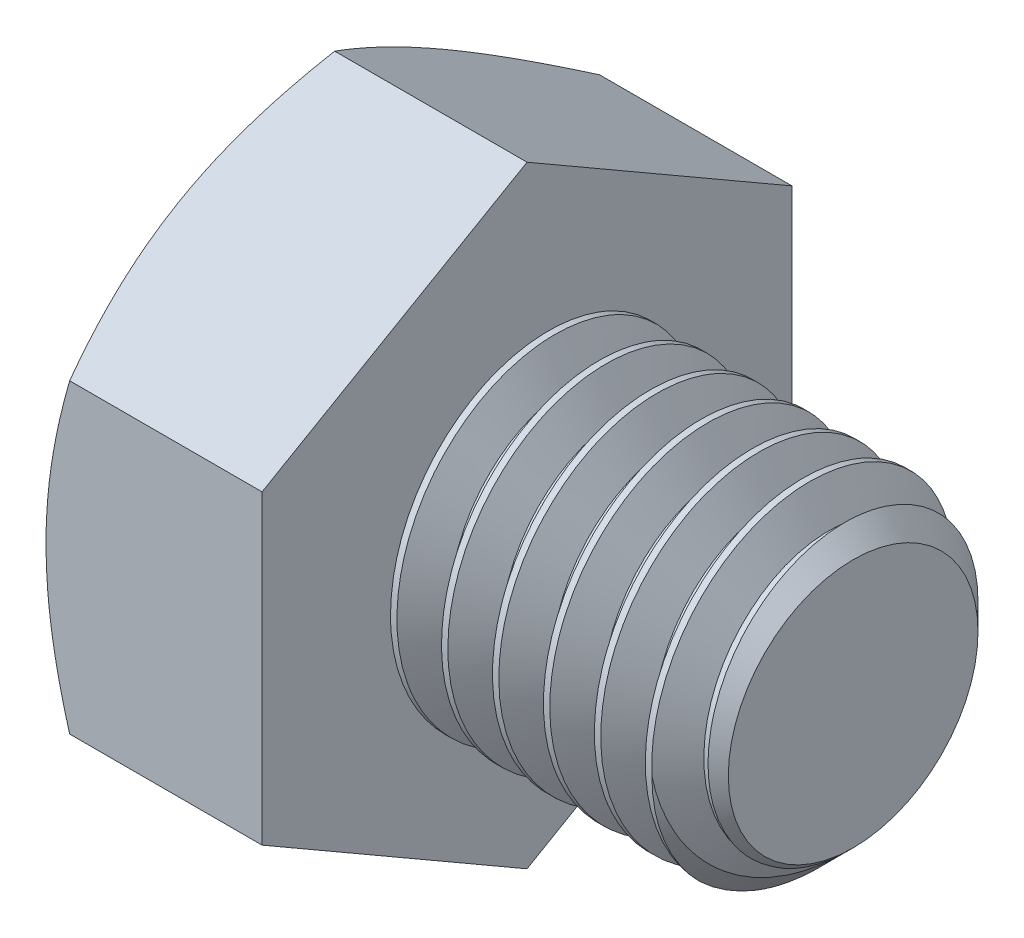
from build123d import *

# Parameters (mm, degrees)
SKETCH2_R           = 4
BOSS_EXTRUDE1_DEPTH = 8
CHAMFER1_SIZE       = 0.9375
CUT_SWEEP1_PITCH    = 1.25
BOSS_EXTRUDE2_DEPTH = 5.3
SKETCH6_OUTSIDE_W   = 80.74
SKETCH6_OUTSIDE_H   = 82.752
SKETCH6_OUTSIDE_R   = 6.5
CUT_EXTRUDE1_DEPTH  = 17.597389517
CUT_EXTRUDE1_DRAFT  = -60
SKETCH7_W           = 0.197562976
SKETCH7_H           = 0.197562976
CUT_EXTRUDE2_DEPTH  = 0.25


with BuildPart() as part:
    # Sketch2 → Boss-Extrude1 (new body)
    with BuildSketch(Plane(origin=(6.65, 0, 0), x_dir=(0, 0, -1), z_dir=(1, 0, 0))):
        Circle(SKETCH2_R)
    extrude(amount=-BOSS_EXTRUDE1_DEPTH)

    # Chamfer1
    chamfer1_edges = [part.edges().sort_by_distance(p)[0] for p in [
        (6.65, 0, 4),
    ]]
    chamfer(chamfer1_edges, length=CHAMFER1_SIZE)

    # Cut-Sweep1: the profile of Sketch5 profile screwed along a right-hand helix of 7.4 turns, 8 arcs to a turn; built about Z, then put on its axis
    cut_sweep1_z = Axis((0, 0, 0), (0, 0, 1))
    cut_sweep1_corners = [(4.0003, 0, 0.000173205), (3.188101184, 0, -0.46875), (3.188101184, 0, -0.625), (4.0003, 0, -1.093923205)]
    with BuildLine(mode=Mode.PRIVATE) as cut_sweep1_profile:
        Line(cut_sweep1_corners[0], cut_sweep1_corners[1])
        Line(cut_sweep1_corners[1], cut_sweep1_corners[2])
        Line(cut_sweep1_corners[2], cut_sweep1_corners[3])
        Line(cut_sweep1_corners[3], cut_sweep1_corners[0])
    cut_sweep1_cap = Face(cut_sweep1_profile.wire())
    cut_sweep1_turn_angles = [0, 22.5, 45, 67.5, 90, 112.5, 135, 157.5, 180, 202.5, 225, 247.5, 270, 292.5, 315, 337.5, 360]
    cut_sweep1_turn_weights = [1, 0.9238795325112867, 1, 0.9238795325112867, 1, 0.9238795325112867, 1, 0.9238795325112867, 1, 0.9238795325112867, 1, 0.9238795325112867, 1, 0.9238795325112867, 1, 0.9238795325112867, 1]
    cut_sweep1_turn_rails = [Edge.make_bspline([Vector(p[0], p[1], 0).rotate(cut_sweep1_z, cut_sweep1_turn_angles[k]) / cut_sweep1_turn_weights[k] + Vector(0, 0, p[2] + CUT_SWEEP1_PITCH * cut_sweep1_turn_angles[k] / 360) for k in range(17)], [0, 0, 0, 1, 1, 2, 2, 3, 3, 4, 4, 5, 5, 6, 6, 7, 7, 8, 8, 8], 2, cut_sweep1_turn_weights) for p in cut_sweep1_corners]
    cut_sweep1_turn_sides = [Face.make_surface_from_curves(cut_sweep1_turn_rails[p[0]], cut_sweep1_turn_rails[p[1]]) for p in [(0, 1), (1, 2), (2, 3), (3, 0)]]
    cut_sweep1_last_angles = [2520, 2542.5, 2565, 2587.5, 2610, 2632.5, 2655, 2659.5, 2664]
    cut_sweep1_last_weights = [1, 0.9238795325112867, 1, 0.9238795325112867, 1, 0.9238795325112867, 1, 0.9969173337331242, 1]
    cut_sweep1_last_rails = [Edge.make_bspline([Vector(p[0], p[1], 0).rotate(cut_sweep1_z, cut_sweep1_last_angles[k]) / cut_sweep1_last_weights[k] + Vector(0, 0, p[2] + CUT_SWEEP1_PITCH * cut_sweep1_last_angles[k] / 360) for k in range(9)], [0, 0, 0, 1, 1, 2, 2, 3, 3, 4, 4, 4], 2, cut_sweep1_last_weights) for p in cut_sweep1_corners]
    cut_sweep1_last_sides = [Face.make_surface_from_curves(cut_sweep1_last_rails[p[0]], cut_sweep1_last_rails[p[1]]) for p in [(0, 1), (1, 2), (2, 3), (3, 0)]]
    cut_sweep1 = Plane(origin=(6.65, 0, 0), x_dir=(0, 1, 0), z_dir=(-1, 0, 0)) * Solid(Shell([*[p.moved(Location((0, 0, CUT_SWEEP1_PITCH * i))) for i in range(7) for p in cut_sweep1_turn_sides], *cut_sweep1_last_sides, cut_sweep1_cap, cut_sweep1_cap.rotate(cut_sweep1_z, 2664).moved(Location((0, 0, CUT_SWEEP1_PITCH * 2664 / 360)))]))
    add(cut_sweep1, mode=Mode.SUBTRACT)

    # Sketch3 → Boss-Extrude2 (add)
    with BuildSketch(Plane.ZY.offset(1.35)):
        Polygon((-6.5, -3.75277675), (0, -7.505553499), (6.5, -3.75277675), (6.5, 3.75277675), (0, 7.505553499), (-6.5, 3.75277675), align=None)
    extrude(amount=BOSS_EXTRUDE2_DEPTH)


with BuildPart() as cut_extrude1_tool:
    # Sketch6 outside → Cut-Extrude1 (with draft: the straight prism first)
    with BuildSketch(Plane.ZY.offset(6.65)):
        Rectangle(SKETCH6_OUTSIDE_W, SKETCH6_OUTSIDE_H)
        Circle(SKETCH6_OUTSIDE_R, mode=Mode.SUBTRACT)
    extrude(amount=-CUT_EXTRUDE1_DEPTH)
    # Cut-Extrude1: the draft: its side faces are tilted about the plane it starts from
    cut_extrude1_sides = [cut_extrude1_tool.faces().sort_by_distance(p)[0] for p in [
        (2.148694759, -41.376, 0),
        (2.148694759, 0, 40.37),
        (2.148694759, 41.376, 0),
        (2.148694759, 0, -40.37),
        (2.148694759, 0, -6.5),
    ]]
    draft(cut_extrude1_sides, Plane.ZY.offset(6.65), CUT_EXTRUDE1_DRAFT)


with BuildPart() as part_1:
    add(part.part)

    # Cut-Extrude1: cut by cut_extrude1_tool
    add(cut_extrude1_tool.part, mode=Mode.SUBTRACT)

    # Sketch7 → Cut-Extrude2 (cut)
    # profile 1 of 3: a face of its own
    with BuildSketch(Plane.ZY.offset(6.65)):
        with BuildLine():
            add(Edge.make_bspline(
                [(-1.090300672, 4.095199106), (-1.10904591, 4.102532349), (-1.144986747, 4.116592608), (-1.19346167, 4.144731144), (-1.234487944, 4.177100824), (-1.26756182, 4.214482221), (-1.292770127, 4.256102561), (-1.310921105, 4.301431184), (-1.321552451, 4.350720623), (-1.322951659, 4.384803), (-1.323671938, 4.402347795)],
                knots=[0, 0, 0, 0, 1.16287356, 2.229614231, 3.228817875, 4.173350329, 5.100165549, 6.029633206, 6.985702163, 8, 8, 8, 8], degree=3))
            add(Edge.make_bspline(
                [(-1.323671938, 4.402347795), (-1.323332936, 4.415847741), (-1.322667465, 4.442348557), (-1.316917644, 4.481234018), (-1.307708477, 4.518496018), (-1.294638515, 4.554029389), (-1.278263995, 4.588126603), (-1.257602111, 4.620162984), (-1.233852559, 4.651043945), (-1.206031088, 4.679521184), (-1.175372308, 4.705603578), (-1.142164064, 4.728814347), (-1.106152247, 4.747795114), (-1.067937276, 4.763664634), (-1.027330198, 4.776088791), (-0.984187971, 4.784550333), (-0.938662683, 4.789932502), (-0.907467674, 4.790632812), (-0.891502928, 4.790991211)],
                knots=[0, 0, 0, 0, 0.994101948, 1.951453197, 2.889123786, 3.817215529, 4.736003873, 5.669743943, 6.620499649, 7.601567446, 8.596478358, 9.582687259, 10.579761808, 11.589151689, 12.62747492, 13.702346593, 14.8241243, 16, 16, 16, 16], degree=3))
            add(Edge.make_bspline(
                [(-0.891502928, 4.790991211), (-0.875436453, 4.790629173), (-0.844140773, 4.789923964), (-0.798373618, 4.78461411), (-0.754959136, 4.775714465), (-0.713922888, 4.763088109), (-0.675200178, 4.746944553), (-0.639045453, 4.727102003), (-0.605086523, 4.703887727), (-0.574191365, 4.677024885), (-0.546080454, 4.647860574), (-0.521725005, 4.616615726), (-0.500836111, 4.584019418), (-0.483574579, 4.54987362), (-0.470804432, 4.513789502), (-0.461070714, 4.476446906), (-0.455424706, 4.43740213), (-0.454742415, 4.410906185), (-0.454394844, 4.39740872)],
                knots=[0, 0, 0, 0, 1.171211919, 2.281388661, 3.353996503, 4.398126828, 5.406889753, 6.407389155, 7.400009931, 8.40008733, 9.387021643, 10.349004252, 11.283445052, 12.206096336, 13.131640667, 14.068727932, 15.016178647, 16, 16, 16, 16], degree=3))
            add(Edge.make_bspline(
                [(-0.454394844, 4.39740872), (-0.454959462, 4.380468619), (-0.45606657, 4.347252266), (-0.467348502, 4.299370618), (-0.484932357, 4.254670699), (-0.510346333, 4.214004413), (-0.542532189, 4.176951768), (-0.58247227, 4.144741497), (-0.629560012, 4.116646938), (-0.6645934, 4.102540833), (-0.682827035, 4.095199106)],
                knots=[0, 0, 0, 0, 0.998680737, 1.958225066, 2.887911823, 3.823713378, 4.77537694, 5.772726054, 6.840782926, 8, 8, 8, 8], degree=3))
            add(Edge.make_bspline(
                [(-0.682827035, 4.095199106), (-0.671322795, 4.091293961), (-0.648779475, 4.083641573), (-0.616909948, 4.06876297), (-0.586905745, 4.052720306), (-0.558597671, 4.035354111), (-0.533030646, 4.015372905), (-0.509351678, 3.993958093), (-0.487660326, 3.970807897), (-0.468252869, 3.945725424), (-0.450925963, 3.919237111), (-0.436092756, 3.891278379), (-0.423495199, 3.862247184), (-0.412728892, 3.832008902), (-0.404864956, 3.800350539), (-0.399362666, 3.767417581), (-0.395871617, 3.733383598), (-0.395377091, 3.71026846), (-0.395125952, 3.698529693)],
                knots=[0, 0, 0, 0, 1.104208047, 2.163768705, 3.193778962, 4.198696312, 5.179575955, 6.14024585, 7.100368562, 8.060719304, 9.021161243, 9.975749006, 10.935506756, 11.897452199, 12.89163552, 13.897859372, 14.932451246, 16, 16, 16, 16], degree=3))
            add(Edge.make_bspline(
                [(-0.395125952, 3.698529693), (-0.395518566, 3.682350494), (-0.396292046, 3.650476238), (-0.403088084, 3.603688571), (-0.413370791, 3.558742632), (-0.428364165, 3.515828291), (-0.447514428, 3.474915209), (-0.471203535, 3.436062798), (-0.499198733, 3.399311024), (-0.530674211, 3.364545652), (-0.565863777, 3.33311926), (-0.603932369, 3.305425676), (-0.645022826, 3.282228768), (-0.688636579, 3.263021811), (-0.734982466, 3.248136491), (-0.784000913, 3.237713611), (-0.835675608, 3.231507244), (-0.871009164, 3.230670526), (-0.889033391, 3.230243702)],
                knots=[0, 0, 0, 0, 1.017598406, 2.004746413, 2.969099523, 3.915171376, 4.859468899, 5.806714415, 6.772805022, 7.762836953, 8.753334612, 9.736396794, 10.719437652, 11.716790048, 12.730404696, 13.776887535, 14.865953843, 16, 16, 16, 16], degree=3))
            add(Edge.make_bspline(
                [(-0.889033391, 3.230243702), (-0.907055815, 3.230679725), (-0.942385837, 3.231534475), (-0.994107744, 3.237613962), (-1.043056058, 3.248509339), (-1.089341685, 3.26340979), (-1.133215708, 3.282096716), (-1.174030202, 3.305816309), (-1.212347458, 3.333474808), (-1.247561492, 3.365095581), (-1.279298421, 3.399857245), (-1.306924581, 3.437151785), (-1.330473058, 3.476405251), (-1.349852944, 3.517838923), (-1.364624836, 3.561453179), (-1.374991925, 3.607084275), (-1.381800265, 3.654697342), (-1.382555285, 3.687186894), (-1.38294083, 3.70377746)],
                knots=[0, 0, 0, 0, 1.127066097, 2.209429196, 3.250843736, 4.258219581, 5.246860502, 6.227045772, 7.204057202, 8.19754525, 9.181483529, 10.142920909, 11.095356922, 12.039670968, 12.998174893, 13.969127444, 14.962948905, 16, 16, 16, 16], degree=3))
            add(Edge.make_bspline(
                [(-1.38294083, 3.70377746), (-1.382672847, 3.716130371), (-1.382147017, 3.74036892), (-1.378934902, 3.775920275), (-1.372533218, 3.809804454), (-1.364287442, 3.842221135), (-1.353817885, 3.873251416), (-1.340901695, 3.902651616), (-1.325231028, 3.930350678), (-1.307428123, 3.956528839), (-1.287268328, 3.981002318), (-1.265078386, 4.003556797), (-1.240777693, 4.023935731), (-1.214912328, 4.04273433), (-1.18639811, 4.058622835), (-1.156295471, 4.073203498), (-1.124086869, 4.0856381), (-1.101675528, 4.091980186), (-1.090300672, 4.095199106)],
                knots=[0, 0, 0, 0, 1.117345089, 2.192424383, 3.22371675, 4.232639188, 5.215561493, 6.182180952, 7.132172269, 8.089790513, 9.041830748, 9.996006267, 10.94686322, 11.907506267, 12.882866327, 13.894317773, 14.931262935, 16, 16, 16, 16], degree=3))
        make_face()
        with BuildLine():
            add(Edge.make_bspline(
                [(-1.126108962, 4.401421718), (-1.125522597, 4.38569432), (-1.124389481, 4.35530201), (-1.112066715, 4.31213196), (-1.092797487, 4.273353149), (-1.070207698, 4.245231653), (-1.048549764, 4.226071024), (-1.030473235, 4.213278152), (-1.010719085, 4.202417262), (-0.989144204, 4.193975494), (-0.966271136, 4.186496613), (-0.941311021, 4.182316462), (-0.914850534, 4.178918248), (-0.896557781, 4.178672138), (-0.887181238, 4.178545986)],
                knots=[0, 0, 0, 0, 1.528727296, 2.954179336, 4.335216052, 5.725683216, 6.435919001, 7.148062981, 7.879427438, 8.626027458, 9.402978632, 10.2190538, 11.08711833, 12, 12, 12, 12], degree=3))
            add(Edge.make_bspline(
                [(-0.887181238, 4.178545986), (-0.878011673, 4.178676799), (-0.860131525, 4.178931878), (-0.83426699, 4.182260813), (-0.809825095, 4.186706918), (-0.787167018, 4.193444308), (-0.766031175, 4.202204879), (-0.74676133, 4.213004501), (-0.728780836, 4.225416366), (-0.707759131, 4.244723381), (-0.685200516, 4.271859952), (-0.665866712, 4.308906458), (-0.653818708, 4.349437535), (-0.652589006, 4.377669794), (-0.65195782, 4.392160954)],
                knots=[0, 0, 0, 0, 0.922112375, 1.798068639, 2.620552757, 3.419964248, 4.17189205, 4.918165909, 5.639229138, 6.36503528, 7.785020832, 9.165298717, 10.544993853, 12, 12, 12, 12], degree=3))
            add(Edge.make_bspline(
                [(-0.65195782, 4.392160954), (-0.65271831, 4.407158684), (-0.654206393, 4.436505357), (-0.666224968, 4.47863383), (-0.68645929, 4.516789644), (-0.709574199, 4.544654295), (-0.730967776, 4.564840594), (-0.749271072, 4.577690525), (-0.768947184, 4.588626954), (-0.790070998, 4.59755802), (-0.812673062, 4.604761018), (-0.8368146, 4.609486531), (-0.862394171, 4.6128007), (-0.879966809, 4.613053896), (-0.889033391, 4.613184533)],
                knots=[0, 0, 0, 0, 1.480633456, 2.897216237, 4.289382554, 5.720567045, 6.454675042, 7.191244726, 7.924224627, 8.676083236, 9.454506446, 10.26432127, 11.104478565, 12, 12, 12, 12], degree=3))
            add(Edge.make_bspline(
                [(-0.889033391, 4.613184533), (-0.898100982, 4.613058121), (-0.915777808, 4.612811688), (-0.941524176, 4.609398068), (-0.965894504, 4.60511063), (-0.988663959, 4.598230085), (-1.009737898, 4.589238813), (-1.029336437, 4.578296242), (-1.047605053, 4.565774542), (-1.069148935, 4.546488383), (-1.091712602, 4.519351198), (-1.111590558, 4.482896368), (-1.123875778, 4.443148301), (-1.125355347, 4.415502855), (-1.126108962, 4.401421718)],
                knots=[0, 0, 0, 0, 0.914830409, 1.783417199, 2.618873138, 3.411020283, 4.179090249, 4.927874451, 5.674348476, 6.410336976, 7.841713217, 9.213201474, 10.580551314, 12, 12, 12, 12], degree=3))
        make_face(mode=Mode.SUBTRACT)
        with BuildLine():
            add(Edge.make_bspline(
                [(-1.185377855, 3.707481766), (-1.185036224, 3.694805043), (-1.184352062, 3.669418206), (-1.17835049, 3.631713372), (-1.168167066, 3.594710671), (-1.155115235, 3.558375151), (-1.136704816, 3.524173378), (-1.11229053, 3.493645779), (-1.081655173, 3.467980015), (-1.046667921, 3.446296603), (-1.008487833, 3.429229893), (-0.968703065, 3.417316749), (-0.928340442, 3.409445139), (-0.901108325, 3.408515353), (-0.88748993, 3.408050381)],
                knots=[0, 0, 0, 0, 0.957879255, 1.91828174, 2.876792425, 3.856375228, 4.831004356, 5.799187063, 6.79220414, 7.836856316, 8.902268238, 9.943090861, 10.971368942, 12, 12, 12, 12], degree=3))
            add(Edge.make_bspline(
                [(-0.88748993, 3.408050381), (-0.876260095, 3.408240606), (-0.854443727, 3.408610159), (-0.822642292, 3.412833099), (-0.792678151, 3.419240679), (-0.764414025, 3.428026522), (-0.738265928, 3.440046137), (-0.713808052, 3.454094456), (-0.691290567, 3.471072925), (-0.670719849, 3.490449644), (-0.65230541, 3.511883927), (-0.636531114, 3.535006834), (-0.62277101, 3.559168091), (-0.611536514, 3.584889135), (-0.603412162, 3.612223005), (-0.597143078, 3.640676539), (-0.593361124, 3.670543219), (-0.59291624, 3.690904396), (-0.592688927, 3.701307923)],
                knots=[0, 0, 0, 0, 1.149387474, 2.232932207, 3.278773642, 4.285224938, 5.256757121, 6.220082341, 7.168479488, 8.137608443, 9.109140627, 10.056190326, 10.999892409, 11.953252726, 12.923240661, 13.915357002, 14.934853301, 16, 16, 16, 16], degree=3))
            add(Edge.make_bspline(
                [(-0.592688927, 3.701307923), (-0.59292348, 3.711915659), (-0.593382696, 3.732683917), (-0.597068538, 3.763206109), (-0.603689152, 3.79216024), (-0.612203291, 3.819983723), (-0.623742382, 3.84619251), (-0.637593446, 3.871162402), (-0.654555372, 3.894235249), (-0.673155477, 3.916194378), (-0.694204567, 3.936072466), (-0.717449351, 3.953214091), (-0.742153148, 3.96835305), (-0.769063272, 3.97996591), (-0.797586855, 3.989268075), (-0.827859408, 3.996027169), (-0.860004362, 4.000158824), (-0.882023513, 4.000542077), (-0.893355081, 4.000739308)],
                knots=[0, 0, 0, 0, 1.065858887, 2.086781919, 3.082735321, 4.047496077, 5.006086125, 5.955204095, 6.910833714, 7.878747924, 8.844339535, 9.812198509, 10.776903849, 11.749116737, 12.749729282, 13.788304076, 14.861809717, 16, 16, 16, 16], degree=3))
            add(Edge.make_bspline(
                [(-0.893355081, 4.000739308), (-0.904378933, 4.000540114), (-0.925989116, 4.000149633), (-0.957382737, 3.995994574), (-0.987102852, 3.989613782), (-1.014887981, 3.980274644), (-1.041085524, 3.968604441), (-1.065216337, 3.953929996), (-1.087710912, 3.936897153), (-1.10788212, 3.917099713), (-1.126081777, 3.89559431), (-1.141817329, 3.872540585), (-1.155718095, 3.848473314), (-1.166267093, 3.822602762), (-1.175195875, 3.795765278), (-1.180777776, 3.767439974), (-1.18474581, 3.737948677), (-1.185164094, 3.717785837), (-1.185377855, 3.707481766)],
                knots=[0, 0, 0, 0, 1.135239447, 2.225422834, 3.256957183, 4.262780498, 5.240265059, 6.205773948, 7.16638056, 8.141101257, 9.111719309, 10.064571387, 11.014055337, 11.969087385, 12.938082716, 13.92369833, 14.938921288, 16, 16, 16, 16], degree=3))
        make_face(mode=Mode.SUBTRACT)
    # profile 2 of 3: a face of its own
    with BuildSketch(Plane.ZY.offset(6.65)):
        with Locations((0, 3.348781488)):
            Rectangle(SKETCH7_W, SKETCH7_H)
    # profile 3 of 3: a face of its own
    with BuildSketch(Plane.ZY.offset(6.65)):
        with BuildLine():
            add(Edge.make_bspline(
                [(0.687766109, 4.095199106), (0.669020872, 4.102532349), (0.633080035, 4.116592608), (0.584605112, 4.144731144), (0.543578838, 4.177100824), (0.510504961, 4.214482221), (0.485296655, 4.256102561), (0.467145677, 4.301431184), (0.456514331, 4.350720623), (0.455115123, 4.384803), (0.454394844, 4.402347795)],
                knots=[0, 0, 0, 0, 1.16287356, 2.229614231, 3.228817875, 4.173350329, 5.100165549, 6.029633206, 6.985702163, 8, 8, 8, 8], degree=3))
            add(Edge.make_bspline(
                [(0.454394844, 4.402347795), (0.454733846, 4.415847741), (0.455399317, 4.442348557), (0.461149138, 4.481234018), (0.470358305, 4.518496018), (0.483428267, 4.554029389), (0.499802787, 4.588126603), (0.520464671, 4.620162984), (0.544214223, 4.651043945), (0.572035694, 4.679521184), (0.602694474, 4.705603578), (0.635902718, 4.728814347), (0.671914535, 4.747795114), (0.710129506, 4.763664634), (0.750736584, 4.776088791), (0.793878811, 4.784550333), (0.839404099, 4.789932502), (0.870599108, 4.790632812), (0.886563854, 4.790991211)],
                knots=[0, 0, 0, 0, 0.994101948, 1.951453197, 2.889123786, 3.817215529, 4.736003873, 5.669743943, 6.620499649, 7.601567446, 8.596478358, 9.582687259, 10.579761808, 11.589151689, 12.62747492, 13.702346593, 14.8241243, 16, 16, 16, 16], degree=3))
            add(Edge.make_bspline(
                [(0.886563854, 4.790991211), (0.902630329, 4.790629173), (0.933926009, 4.789923964), (0.979693164, 4.78461411), (1.023107646, 4.775714465), (1.064143894, 4.763088109), (1.102866604, 4.746944553), (1.139021329, 4.727102003), (1.172980259, 4.703887727), (1.203875417, 4.677024885), (1.231986328, 4.647860574), (1.256341777, 4.616615726), (1.277230671, 4.584019418), (1.294492203, 4.54987362), (1.30726235, 4.513789502), (1.316996068, 4.476446906), (1.322642076, 4.43740213), (1.323324367, 4.410906185), (1.323671938, 4.39740872)],
                knots=[0, 0, 0, 0, 1.171211919, 2.281388661, 3.353996503, 4.398126828, 5.406889753, 6.407389155, 7.400009931, 8.40008733, 9.387021643, 10.349004252, 11.283445052, 12.206096336, 13.131640667, 14.068727932, 15.016178647, 16, 16, 16, 16], degree=3))
            add(Edge.make_bspline(
                [(1.323671938, 4.39740872), (1.32310732, 4.380468619), (1.322000212, 4.347252266), (1.31071828, 4.299370618), (1.293134425, 4.254670699), (1.267720449, 4.214004413), (1.235534593, 4.176951768), (1.195594512, 4.144741497), (1.148506769, 4.116646938), (1.113473382, 4.102540833), (1.095239747, 4.095199106)],
                knots=[0, 0, 0, 0, 0.998680737, 1.958225066, 2.887911823, 3.823713378, 4.77537694, 5.772726054, 6.840782926, 8, 8, 8, 8], degree=3))
            add(Edge.make_bspline(
                [(1.095239747, 4.095199106), (1.106743987, 4.091293961), (1.129287306, 4.083641573), (1.161156834, 4.06876297), (1.191161037, 4.052720306), (1.219469111, 4.035354111), (1.245036136, 4.015372905), (1.268715103, 3.993958093), (1.290406456, 3.970807897), (1.309813913, 3.945725424), (1.327140819, 3.919237111), (1.341974025, 3.891278379), (1.354571583, 3.862247184), (1.36533789, 3.832008902), (1.373201826, 3.800350539), (1.378704116, 3.767417581), (1.382195165, 3.733383598), (1.382689691, 3.71026846), (1.38294083, 3.698529693)],
                knots=[0, 0, 0, 0, 1.104208047, 2.163768705, 3.193778962, 4.198696312, 5.179575955, 6.14024585, 7.100368562, 8.060719304, 9.021161243, 9.975749006, 10.935506756, 11.897452199, 12.89163552, 13.897859372, 14.932451246, 16, 16, 16, 16], degree=3))
            add(Edge.make_bspline(
                [(1.38294083, 3.698529693), (1.382548216, 3.682350494), (1.381774736, 3.650476238), (1.374978698, 3.603688571), (1.364695991, 3.558742632), (1.349702617, 3.515828291), (1.330552354, 3.474915209), (1.306863247, 3.436062798), (1.278868049, 3.399311024), (1.247392571, 3.364545652), (1.212203005, 3.33311926), (1.174134413, 3.305425676), (1.133043956, 3.282228768), (1.089430203, 3.263021811), (1.043084316, 3.248136491), (0.994065869, 3.237713611), (0.942391174, 3.231507244), (0.907057618, 3.230670526), (0.889033391, 3.230243702)],
                knots=[0, 0, 0, 0, 1.017598406, 2.004746413, 2.969099523, 3.915171376, 4.859468899, 5.806714415, 6.772805022, 7.762836953, 8.753334612, 9.736396794, 10.719437652, 11.716790048, 12.730404696, 13.776887535, 14.865953843, 16, 16, 16, 16], degree=3))
            add(Edge.make_bspline(
                [(0.889033391, 3.230243702), (0.871010967, 3.230679725), (0.835680945, 3.231534475), (0.783959037, 3.237613962), (0.735010724, 3.248509339), (0.688725097, 3.26340979), (0.644851074, 3.282096716), (0.60403658, 3.305816309), (0.565719324, 3.333474808), (0.53050529, 3.365095581), (0.49876836, 3.399857245), (0.471142201, 3.437151785), (0.447593724, 3.476405251), (0.428213838, 3.517838923), (0.413441946, 3.561453179), (0.403074856, 3.607084275), (0.396266517, 3.654697342), (0.395511497, 3.687186894), (0.395125952, 3.70377746)],
                knots=[0, 0, 0, 0, 1.127066097, 2.209429196, 3.250843736, 4.258219581, 5.246860502, 6.227045772, 7.204057202, 8.19754525, 9.181483529, 10.142920909, 11.095356922, 12.039670968, 12.998174893, 13.969127444, 14.962948905, 16, 16, 16, 16], degree=3))
            add(Edge.make_bspline(
                [(0.395125952, 3.70377746), (0.395393935, 3.716130371), (0.395919765, 3.74036892), (0.39913188, 3.775920275), (0.405533564, 3.809804454), (0.41377934, 3.842221135), (0.424248897, 3.873251416), (0.437165087, 3.902651616), (0.452835754, 3.930350678), (0.470638659, 3.956528839), (0.490798454, 3.981002318), (0.512988396, 4.003556797), (0.537289089, 4.023935731), (0.563154454, 4.04273433), (0.591668672, 4.058622835), (0.621771311, 4.073203498), (0.653979913, 4.0856381), (0.676391254, 4.091980186), (0.687766109, 4.095199106)],
                knots=[0, 0, 0, 0, 1.117345089, 2.192424383, 3.22371675, 4.232639188, 5.215561493, 6.182180952, 7.132172269, 8.089790513, 9.041830748, 9.996006267, 10.94686322, 11.907506267, 12.882866327, 13.894317773, 14.931262935, 16, 16, 16, 16], degree=3))
        make_face()
        with BuildLine():
            add(Edge.make_bspline(
                [(0.65195782, 4.401421718), (0.652544185, 4.38569432), (0.653677301, 4.35530201), (0.666000066, 4.31213196), (0.685269295, 4.273353149), (0.707859084, 4.245231653), (0.729517018, 4.226071024), (0.747593547, 4.213278152), (0.767347697, 4.202417262), (0.788922578, 4.193975494), (0.811795646, 4.186496613), (0.83675576, 4.182316462), (0.863216248, 4.178918248), (0.881509001, 4.178672138), (0.890885544, 4.178545986)],
                knots=[0, 0, 0, 0, 1.528727296, 2.954179336, 4.335216052, 5.725683216, 6.435919001, 7.148062981, 7.879427438, 8.626027458, 9.402978632, 10.2190538, 11.08711833, 12, 12, 12, 12], degree=3))
            add(Edge.make_bspline(
                [(0.890885544, 4.178545986), (0.900055108, 4.178676799), (0.917935257, 4.178931878), (0.943799792, 4.182260813), (0.968241687, 4.186706918), (0.990899763, 4.193444308), (1.012035607, 4.202204879), (1.031305452, 4.213004501), (1.049285946, 4.225416366), (1.070307651, 4.244723381), (1.092866266, 4.271859952), (1.11220007, 4.308906458), (1.124248074, 4.349437535), (1.125477776, 4.377669794), (1.126108962, 4.392160954)],
                knots=[0, 0, 0, 0, 0.922112375, 1.798068639, 2.620552757, 3.419964248, 4.17189205, 4.918165909, 5.639229138, 6.36503528, 7.785020832, 9.165298717, 10.544993853, 12, 12, 12, 12], degree=3))
            add(Edge.make_bspline(
                [(1.126108962, 4.392160954), (1.125348471, 4.407158684), (1.123860389, 4.436505357), (1.111841814, 4.47863383), (1.091607492, 4.516789644), (1.068492583, 4.544654295), (1.047099006, 4.564840594), (1.02879571, 4.577690525), (1.009119598, 4.588626954), (0.987995784, 4.59755802), (0.96539372, 4.604761018), (0.941252181, 4.609486531), (0.915672611, 4.6128007), (0.898099973, 4.613053896), (0.889033391, 4.613184533)],
                knots=[0, 0, 0, 0, 1.480633456, 2.897216237, 4.289382554, 5.720567045, 6.454675042, 7.191244726, 7.924224627, 8.676083236, 9.454506446, 10.26432127, 11.104478565, 12, 12, 12, 12], degree=3))
            add(Edge.make_bspline(
                [(0.889033391, 4.613184533), (0.8799658, 4.613058121), (0.862288974, 4.612811688), (0.836542606, 4.609398068), (0.812172278, 4.60511063), (0.789402822, 4.598230085), (0.768328884, 4.589238813), (0.748730345, 4.578296242), (0.730461729, 4.565774542), (0.708917847, 4.546488383), (0.68635418, 4.519351198), (0.666476224, 4.482896368), (0.654191004, 4.443148301), (0.652711435, 4.415502855), (0.65195782, 4.401421718)],
                knots=[0, 0, 0, 0, 0.914830409, 1.783417199, 2.618873138, 3.411020283, 4.179090249, 4.927874451, 5.674348476, 6.410336976, 7.841713217, 9.213201474, 10.580551314, 12, 12, 12, 12], degree=3))
        make_face(mode=Mode.SUBTRACT)
        with BuildLine():
            add(Edge.make_bspline(
                [(0.592688927, 3.707481766), (0.593030558, 3.694805043), (0.59371472, 3.669418206), (0.599716292, 3.631713372), (0.609899716, 3.594710671), (0.622951547, 3.558375151), (0.641361966, 3.524173378), (0.665776252, 3.493645779), (0.696411609, 3.467980015), (0.731398861, 3.446296603), (0.769578949, 3.429229893), (0.809363717, 3.417316749), (0.84972634, 3.409445139), (0.876958457, 3.408515353), (0.890576852, 3.408050381)],
                knots=[0, 0, 0, 0, 0.957879255, 1.91828174, 2.876792425, 3.856375228, 4.831004356, 5.799187063, 6.79220414, 7.836856316, 8.902268238, 9.943090861, 10.971368942, 12, 12, 12, 12], degree=3))
            add(Edge.make_bspline(
                [(0.890576852, 3.408050381), (0.901806687, 3.408240606), (0.923623055, 3.408610159), (0.955424489, 3.412833099), (0.98538863, 3.419240679), (1.013652757, 3.428026522), (1.039800853, 3.440046137), (1.06425873, 3.454094456), (1.086776215, 3.471072925), (1.107346933, 3.490449644), (1.125761372, 3.511883927), (1.141535667, 3.535006834), (1.155295772, 3.559168091), (1.166530268, 3.584889135), (1.17465462, 3.612223005), (1.180923704, 3.640676539), (1.184705658, 3.670543219), (1.185150542, 3.690904396), (1.185377855, 3.701307923)],
                knots=[0, 0, 0, 0, 1.149387474, 2.232932207, 3.278773642, 4.285224938, 5.256757121, 6.220082341, 7.168479488, 8.137608443, 9.109140627, 10.056190326, 10.999892409, 11.953252726, 12.923240661, 13.915357002, 14.934853301, 16, 16, 16, 16], degree=3))
            add(Edge.make_bspline(
                [(1.185377855, 3.701307923), (1.185143302, 3.711915659), (1.184684086, 3.732683917), (1.180998244, 3.763206109), (1.174377629, 3.79216024), (1.165863491, 3.819983723), (1.1543244, 3.84619251), (1.140473336, 3.871162402), (1.12351141, 3.894235249), (1.104911305, 3.916194378), (1.083862215, 3.936072466), (1.060617431, 3.953214091), (1.035913634, 3.96835305), (1.00900351, 3.97996591), (0.980479927, 3.989268075), (0.950207373, 3.996027169), (0.91806242, 4.000158824), (0.896043269, 4.000542077), (0.884711701, 4.000739308)],
                knots=[0, 0, 0, 0, 1.065858887, 2.086781919, 3.082735321, 4.047496077, 5.006086125, 5.955204095, 6.910833714, 7.878747924, 8.844339535, 9.812198509, 10.776903849, 11.749116737, 12.749729282, 13.788304076, 14.861809717, 16, 16, 16, 16], degree=3))
            add(Edge.make_bspline(
                [(0.884711701, 4.000739308), (0.873687849, 4.000540114), (0.852077666, 4.000149633), (0.820684044, 3.995994574), (0.79096393, 3.989613782), (0.763178801, 3.980274644), (0.736981258, 3.968604441), (0.712850445, 3.953929996), (0.69035587, 3.936897153), (0.670184662, 3.917099713), (0.651985005, 3.89559431), (0.636249453, 3.872540585), (0.622348687, 3.848473314), (0.611799689, 3.822602762), (0.602870907, 3.795765278), (0.597289006, 3.767439974), (0.593320972, 3.737948677), (0.592902688, 3.717785837), (0.592688927, 3.707481766)],
                knots=[0, 0, 0, 0, 1.135239447, 2.225422834, 3.256957183, 4.262780498, 5.240265059, 6.205773948, 7.16638056, 8.141101257, 9.111719309, 10.064571387, 11.014055337, 11.969087385, 12.938082716, 13.92369833, 14.938921288, 16, 16, 16, 16], degree=3))
        make_face(mode=Mode.SUBTRACT)
    extrude(amount=-CUT_EXTRUDE2_DEPTH, mode=Mode.SUBTRACT)


solid = part_1.part
